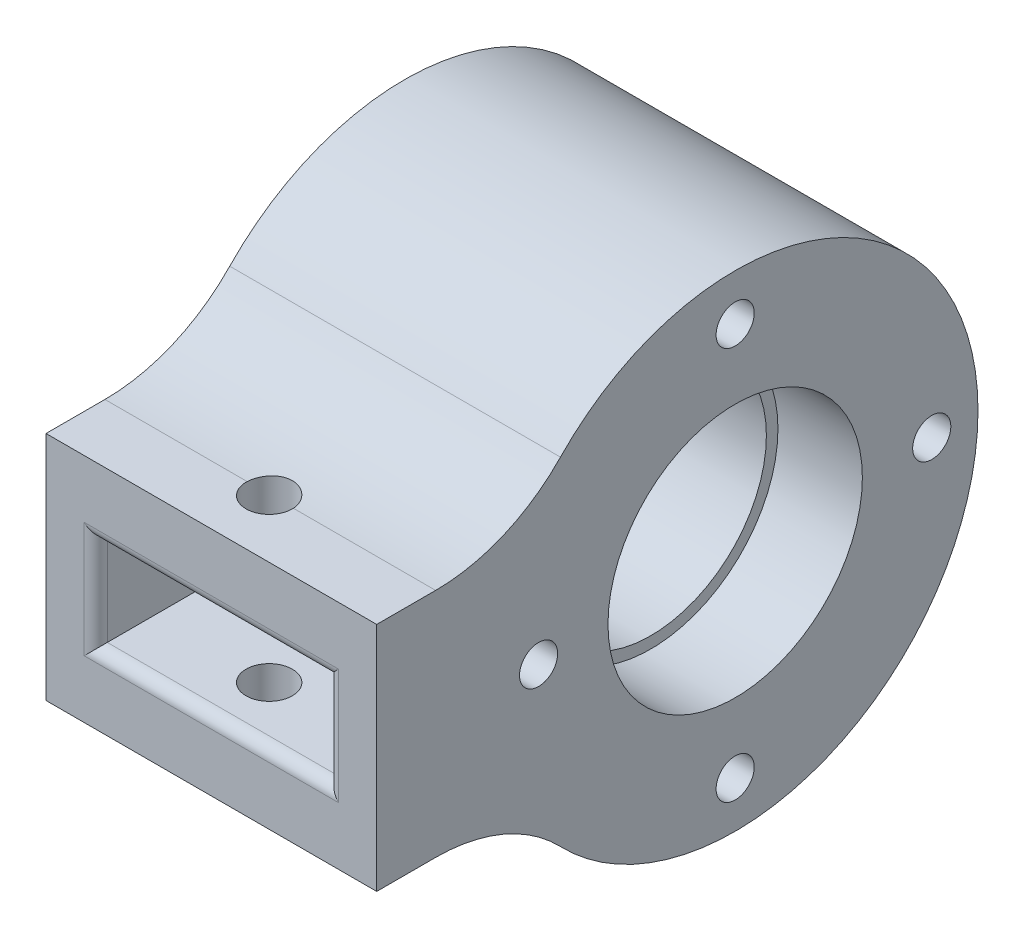
from build123d import *

# Parameters (mm, degrees)
SKETCH3_R                  = 21
SKETCH3_R_2                = 11
BOSS_EXTRUDE1_DEPTH        = 14.3
SKETCH4_R                  = 21
SKETCH4_R_2                = 10
BOSS_EXTRUDE2_DEPTH        = 7
M4_TAPPED_HOLE1_AT_2_COUNT = 2
M4_TAPPED_HOLE1_AT_2_PITCH = 24.04163056
M4_TAPPED_HOLE1_AT_3_COUNT = 2
M4_TAPPED_HOLE1_AT_3_PITCH = 34
M4_TAPPED_HOLE1_AT_4_COUNT = 2
M4_TAPPED_HOLE1_AT_4_PITCH = 24.04163056
BOSS_EXTRUDE3_REACH        = 59.875
BOSS_EXTRUDE3_END_RADIUS   = 21
SKETCH7_W                  = 28.6
SKETCH7_H                  = 20
SKETCH11_W                 = 20
SKETCH11_H                 = 8
CUT_EXTRUDE2_DEPTH         = 10
SKETCH12_R                 = 2
CUT_EXTRUDE3_DEPTH         = 47.113880774
FILLET1_R                  = 15
FILLET5_R                  = 1
M8_TAPPED_HOLE1_D          = 6.8
M8_TAPPED_HOLE1_DEPTH      = 19.75
M8_TAPPED_HOLE1_TIP        = 2.042926105


with BuildPart() as part:
    # Sketch3 → Boss-Extrude1 (new body)
    with BuildSketch(Plane(origin=(0, 0, 0), x_dir=(0, 0, -1), z_dir=(1, 0, 0))):
        Circle(SKETCH3_R)
        Circle(SKETCH3_R_2, mode=Mode.SUBTRACT)
    boss_extrude1 = extrude(amount=BOSS_EXTRUDE1_DEPTH)

    # Sketch4 → Boss-Extrude2 (add)
    with BuildSketch(Plane(origin=(0, 0, 0), x_dir=(0, 0, -1), z_dir=(1, 0, 0))):
        Circle(SKETCH4_R)
        Circle(SKETCH4_R_2, mode=Mode.SUBTRACT)
    boss_extrude2 = extrude(amount=BOSS_EXTRUDE2_DEPTH)

    # Sketch15 → M4 Tapped Hole1 (revolve, cut)
    with BuildSketch(Plane(origin=(14.3, 17, 0), x_dir=(0, 0, -1), z_dir=(0, 1, 0))):
        Polygon((0, 0), (0, 8.991420021), (1.65, 8), (1.65, 0), align=None)
    m4_tapped_hole1 = revolve(axis=Axis((20.65, 17, 0), (-1, 0, 0)), mode=Mode.SUBTRACT)

    # M4 Tapped Hole1 at 2: M4 Tapped Hole1 ×2
    with Locations(*[Vector(0, -0.7071067811865479, -0.7071067811865472) * (i * M4_TAPPED_HOLE1_AT_2_PITCH) for i in range(1, M4_TAPPED_HOLE1_AT_2_COUNT)]):
        add(m4_tapped_hole1, mode=Mode.SUBTRACT)

    # M4 Tapped Hole1 at 3: M4 Tapped Hole1 ×2
    with Locations(*[(0, -i * M4_TAPPED_HOLE1_AT_3_PITCH, 0) for i in range(1, M4_TAPPED_HOLE1_AT_3_COUNT)]):
        add(m4_tapped_hole1, mode=Mode.SUBTRACT)

    # M4 Tapped Hole1 at 4: M4 Tapped Hole1 ×2
    with Locations(*[Vector(0, -0.7071067811865474, 0.7071067811865478) * (i * M4_TAPPED_HOLE1_AT_4_PITCH) for i in range(1, M4_TAPPED_HOLE1_AT_4_COUNT)]):
        add(m4_tapped_hole1, mode=Mode.SUBTRACT)

    # Mirror1: Boss-Extrude1, Boss-Extrude2, M4 Tapped Hole1 across plane
    add(boss_extrude1.mirror(Plane(origin=(0, 0, 0), x_dir=(0, 0, 1), z_dir=(1, 0, 0))))
    add(boss_extrude2.mirror(Plane(origin=(0, 0, 0), x_dir=(0, 0, 1), z_dir=(1, 0, 0))))
    add(m4_tapped_hole1.mirror(Plane(origin=(0, 0, 0), x_dir=(0, 0, 1), z_dir=(1, 0, 0))), mode=Mode.SUBTRACT)

    # Mirror1 copy 1 sketch → Mirror1 copy 1 (revolve, cut)
    with BuildSketch(Plane(origin=(-14.3, 0, -17), x_dir=(0, 0, -1), z_dir=(0, 1, 0))):
        Polygon((0, 0), (0, -8.991420021), (1.65, -8), (1.65, 0), align=None)
    revolve(axis=Axis((-20.65, 0, -17), (-1, 0, 0)), mode=Mode.SUBTRACT)

    # Mirror1 copy 2 sketch → Mirror1 copy 2 (revolve, cut)
    with BuildSketch(Plane(origin=(-14.3, -17, 0), x_dir=(0, 0, -1), z_dir=(0, 1, 0))):
        Polygon((0, 0), (0, -8.991420021), (1.65, -8), (1.65, 0), align=None)
    revolve(axis=Axis((-20.65, -17, 0), (-1, 0, 0)), mode=Mode.SUBTRACT)

    # Mirror1 copy 3 sketch → Mirror1 copy 3 (revolve, cut)
    with BuildSketch(Plane(origin=(-14.3, 0, 17), x_dir=(0, 0, -1), z_dir=(0, 1, 0))):
        Polygon((0, 0), (0, -8.991420021), (1.65, -8), (1.65, 0), align=None)
    revolve(axis=Axis((-20.65, 0, 17), (-1, 0, 0)), mode=Mode.SUBTRACT)

    # Boss-Extrude3: up to this cylinder (the profile starts outside it)
    boss_extrude3_end = Plane(origin=(0, 0, 0), z_dir=(-1, 0, 0)) * Cylinder(BOSS_EXTRUDE3_END_RADIUS, 162.75, mode=Mode.PRIVATE)
    # Sketch7 → Boss-Extrude3 (add, up to the surface)
    with BuildSketch(Plane.XY.offset(31), mode=Mode.PRIVATE) as boss_extrude3_sk1:
        Rectangle(SKETCH7_W, SKETCH7_H)
    boss_extrude3_tool1 = extrude(boss_extrude3_sk1.sketch, amount=-BOSS_EXTRUDE3_REACH, mode=Mode.PRIVATE) - boss_extrude3_end
    add(boss_extrude3_tool1.solids().sort_by_distance((0, 0, 31))[0])

    # Sketch11 → Cut-Extrude2 (cut)
    with BuildSketch(Plane.XY.offset(31)):
        Rectangle(SKETCH11_W, SKETCH11_H)
    extrude(amount=-CUT_EXTRUDE2_DEPTH, mode=Mode.SUBTRACT)

    # Sketch12 → Cut-Extrude3 (cut, through all)
    with BuildSketch(Plane(origin=(0, 10, 0), x_dir=(1, 0, 0), z_dir=(0, 1, 0))):
        with Locations(Location((0, -26, 0), (0, 0, 180))):
            Circle(SKETCH12_R)
    extrude(amount=-CUT_EXTRUDE3_DEPTH, mode=Mode.SUBTRACT)

    # Fillet1
    # the kernel refuses this fillet: 15 mm, written as the material it adds along each edge
    with BuildSketch(Plane(origin=(14.3, -10, 18.466185313), x_dir=(0, -0.8068579760983849, -0.5907454666829176), z_dir=(-1, 0, 0))) as fillet1_piece_1_section:
        with BuildLine():
            CenterArc((7.709210641, 14.862173982), FILLET1_R, 216.20992664, 46.01703687)
            Line((-4.393659, 6.000991981), (0, 0))
            ThreePointArc((0, 0), (2.840235499, 0.192956426), (5.680470999, 0))
        make_face()
    fillet1_piece_1 = extrude(amount=28.6, mode=Mode.PRIVATE)
    fillet1_piece_1 = fillet1_piece_1 - Plane(origin=(0, -10.967889591, 26), x_dir=(-1, 0, 0), z_dir=(0, 1, 0)) * Cylinder(2, 82, mode=Mode.PRIVATE)
    add(fillet1_piece_1)
    with BuildSketch(Plane(origin=(14.3, 10, 18.466185313), x_dir=(0, 0.8068579760983845, -0.5907454666829182), z_dir=(-1, 0, 0))) as fillet1_piece_2_section:
        with BuildLine():
            CenterArc((7.709210641, -14.862173982), FILLET1_R, 97.773036491, 46.01703687)
            Line((-4.393659, -6.000991981), (0, 0))
            ThreePointArc((0, 0), (2.840235499, -0.192956426), (5.680470999, 0))
        make_face()
    fillet1_piece_2 = extrude(amount=28.6, mode=Mode.PRIVATE)
    fillet1_piece_2 = fillet1_piece_2 - Plane(origin=(0, 10.967889591, 26), x_dir=(-1, 0, 0), z_dir=(0, 1, 0)) * Cylinder(2, 82, mode=Mode.PRIVATE)
    add(fillet1_piece_2)

    # Fillet5
    fillet5_edges = [part.edges().sort_by_distance(p)[0] for p in [
        (10, 0, 31),
        (0, 4, 31),
        (-10, 0, 31),
        (0, -4, 31),
    ]]
    fillet(fillet5_edges, radius=FILLET5_R)

    # M8 Tapped Hole1
    with Locations(Plane.XY.offset(21)):
        with Locations((0, 0)):
            Hole(M8_TAPPED_HOLE1_D / 2, depth=M8_TAPPED_HOLE1_DEPTH)
            with Locations((0, 0, -(M8_TAPPED_HOLE1_DEPTH + M8_TAPPED_HOLE1_TIP / 2))):  # 118° drill point
                Cone(0, M8_TAPPED_HOLE1_D / 2, M8_TAPPED_HOLE1_TIP, mode=Mode.SUBTRACT)


solid = part.part
